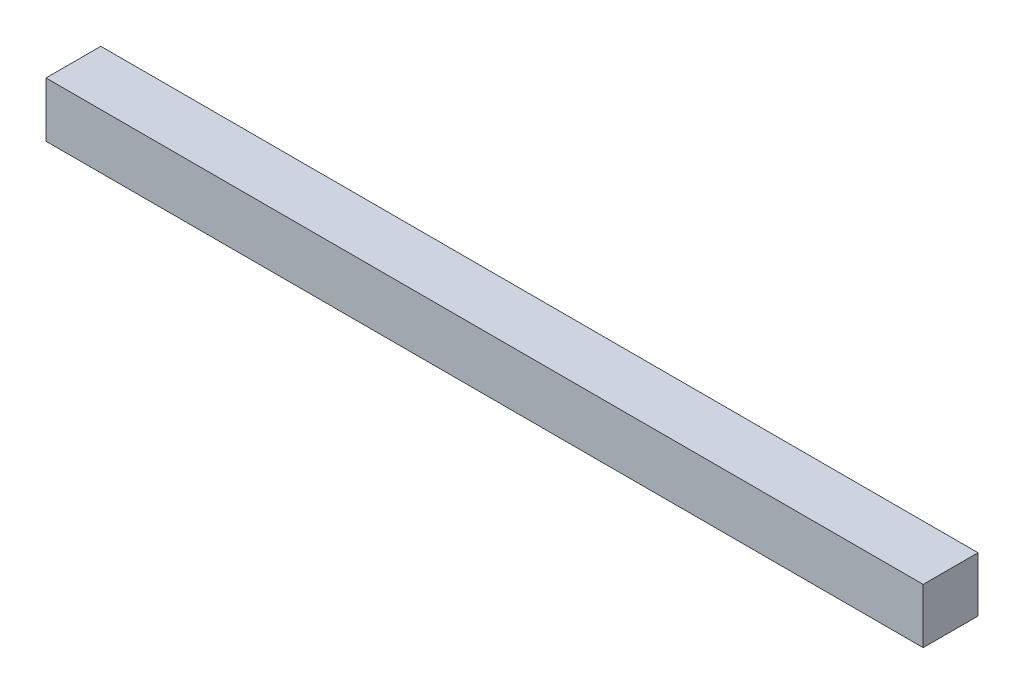
from build123d import *

# Parameters (mm, degrees)
SKETCH2_W           = 6.35
SKETCH2_H           = 6.35
BOSS_EXTRUDE1_DEPTH = 50.8


with BuildPart() as part:
    # Sketch2 → Boss-Extrude1 (new, symmetric)
    with BuildSketch(Plane(origin=(0, 0, 0), x_dir=(0, 0, -1), z_dir=(1, 0, 0))):
        Rectangle(SKETCH2_W, SKETCH2_H)
    extrude(amount=BOSS_EXTRUDE1_DEPTH, both=True)


solid = part.part
